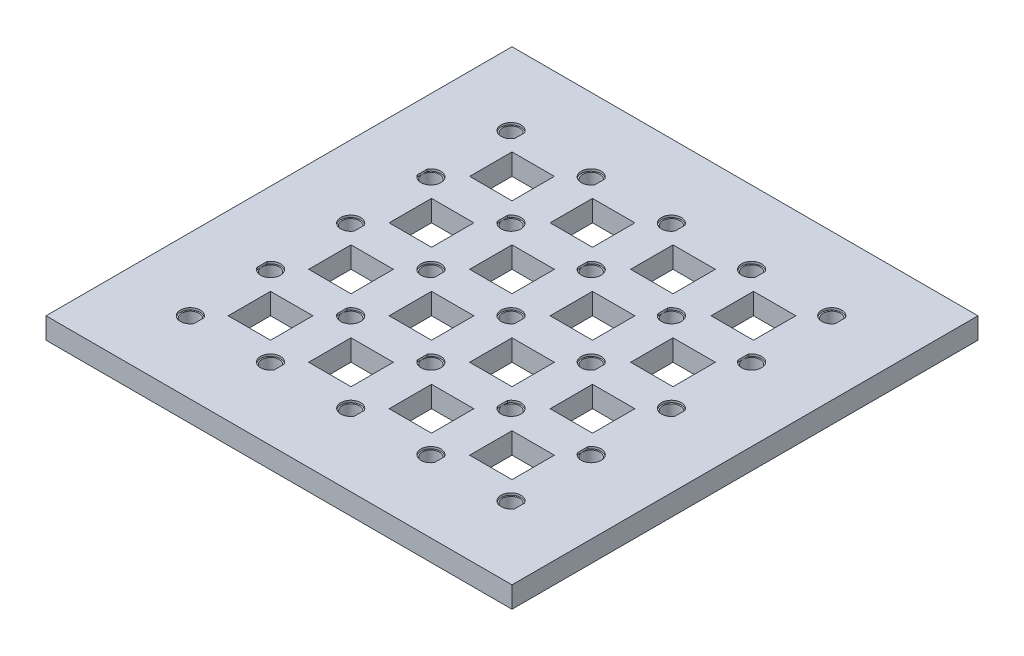
from build123d import *

# Parameters (mm, degrees)
SKETCH1_W           = 220
SKETCH1_H           = 220
BOSS_EXTRUDE1_DEPTH = 10
SKETCH2_R           = 4.075
CUT_EXTRUDE1_DEPTH  = 10
CUT_EXTRUDE2_DEPTH  = 1
SKETCH4_W           = 20
SKETCH4_H           = 20
CUT_EXTRUDE3_DEPTH  = 156.884572681


with BuildPart() as part:
    # Sketch1 → Boss-Extrude1 (new body)
    with BuildSketch(Plane(origin=(0, 0, 0), x_dir=(1, 0, 0), z_dir=(0, 1, 0))):
        Rectangle(SKETCH1_W, SKETCH1_H)
    extrude(amount=BOSS_EXTRUDE1_DEPTH)

    # Sketch2 → Cut-Extrude1 (cut)
    with BuildSketch(Plane(origin=(0, 10, 0), x_dir=(1, 0, 0), z_dir=(0, 1, 0))):
        with Locations((-75.925, -75.925)):
            Circle(SKETCH2_R)
        with Locations((-38.075, -75.925)):
            Circle(SKETCH2_R)
        with Locations((-0.225, -75.925)):
            Circle(SKETCH2_R)
        with Locations((37.625, -75.925)):
            Circle(SKETCH2_R)
        with Locations((75.475, -75.925)):
            Circle(SKETCH2_R)
        with Locations((-75.925, -38.075)):
            Circle(SKETCH2_R)
        with Locations((-38.075, -38.075)):
            Circle(SKETCH2_R)
        with Locations((-0.225, -38.075)):
            Circle(SKETCH2_R)
        with Locations((37.625, -38.075)):
            Circle(SKETCH2_R)
        with Locations((75.475, -38.075)):
            Circle(SKETCH2_R)
        with Locations((-75.925, -0.225)):
            Circle(SKETCH2_R)
        with Locations((-38.075, -0.225)):
            Circle(SKETCH2_R)
        with Locations((-0.225, -0.225)):
            Circle(SKETCH2_R)
        with Locations((37.625, -0.225)):
            Circle(SKETCH2_R)
        with Locations((75.475, -0.225)):
            Circle(SKETCH2_R)
        with Locations((-75.925, 37.625)):
            Circle(SKETCH2_R)
        with Locations((-38.075, 37.625)):
            Circle(SKETCH2_R)
        with Locations((-0.225, 37.625)):
            Circle(SKETCH2_R)
        with Locations((37.625, 37.625)):
            Circle(SKETCH2_R)
        with Locations((75.475, 37.625)):
            Circle(SKETCH2_R)
        with Locations((-75.925, 75.475)):
            Circle(SKETCH2_R)
        with Locations((-38.075, 75.475)):
            Circle(SKETCH2_R)
        with Locations((-0.225, 75.475)):
            Circle(SKETCH2_R)
        with Locations((37.625, 75.475)):
            Circle(SKETCH2_R)
        with Locations((75.475, 75.475)):
            Circle(SKETCH2_R)
    extrude(amount=-CUT_EXTRUDE1_DEPTH, mode=Mode.SUBTRACT)

    # Sketch3 → Cut-Extrude2 (cut)
    with BuildSketch(Plane(origin=(0, 10, 0), x_dir=(1, 0, 0), z_dir=(0, 1, 0))):
        with BuildLine():
            Line((-71.85, -78.266874249), (-71.85, -73.583125751))
            ThreePointArc((-71.85, -73.583125751), (-80.625, -75.925), (-71.85, -78.266874249))
        make_face()
        with BuildLine():
            Line((-80, -35.733125751), (-80, -40.416874249))
            ThreePointArc((-80, -40.416874249), (-71.225, -38.075), (-80, -35.733125751))
        make_face()
        with BuildLine():
            Line((-71.85, -2.566874249), (-71.85, 2.116874249))
            ThreePointArc((-71.85, 2.116874249), (-80.625, -0.225), (-71.85, -2.566874249))
        make_face()
        with BuildLine():
            Line((-80, 39.966874249), (-80, 35.283125751))
            ThreePointArc((-80, 35.283125751), (-71.225, 37.625), (-80, 39.966874249))
        make_face()
        with BuildLine():
            Line((-71.85, 73.133125751), (-71.85, 77.816874249))
            ThreePointArc((-71.85, 77.816874249), (-80.625, 75.475), (-71.85, 73.133125751))
        make_face()
        with BuildLine():
            Line((-34, 73.133125751), (-34, 77.816874249))
            ThreePointArc((-34, 77.816874249), (-42.775, 75.475), (-34, 73.133125751))
        make_face()
        with BuildLine():
            Line((-42.15, 39.966874249), (-42.15, 35.283125751))
            ThreePointArc((-42.15, 35.283125751), (-33.375, 37.625), (-42.15, 39.966874249))
        make_face()
        with BuildLine():
            Line((-34, -2.566874249), (-34, 2.116874249))
            ThreePointArc((-34, 2.116874249), (-42.775, -0.225), (-34, -2.566874249))
        make_face()
        with BuildLine():
            Line((-34, -78.266874249), (-34, -73.583125751))
            ThreePointArc((-34, -73.583125751), (-42.775, -75.925), (-34, -78.266874249))
        make_face()
        with BuildLine():
            Line((-42.15, -35.733125751), (-42.15, -40.416874249))
            ThreePointArc((-42.15, -40.416874249), (-33.375, -38.075), (-42.15, -35.733125751))
        make_face()
        with BuildLine():
            Line((3.85, 73.133125751), (3.85, 77.816874249))
            ThreePointArc((3.85, 77.816874249), (-4.925, 75.475), (3.85, 73.133125751))
        make_face()
        with BuildLine():
            Line((-4.3, 39.966874249), (-4.3, 35.283125751))
            ThreePointArc((-4.3, 35.283125751), (4.475, 37.625), (-4.3, 39.966874249))
        make_face()
        with BuildLine():
            Line((3.85, -2.566874249), (3.85, 2.116874249))
            ThreePointArc((3.85, 2.116874249), (-4.925, -0.225), (3.85, -2.566874249))
        make_face()
        with BuildLine():
            Line((3.85, -78.266874249), (3.85, -73.583125751))
            ThreePointArc((3.85, -73.583125751), (-4.925, -75.925), (3.85, -78.266874249))
        make_face()
        with BuildLine():
            Line((-4.3, -35.733125751), (-4.3, -40.416874249))
            ThreePointArc((-4.3, -40.416874249), (4.475, -38.075), (-4.3, -35.733125751))
        make_face()
        with BuildLine():
            Line((41.7, 73.133125751), (41.7, 77.816874249))
            ThreePointArc((41.7, 77.816874249), (32.925, 75.475), (41.7, 73.133125751))
        make_face()
        with BuildLine():
            Line((33.55, 39.966874249), (33.55, 35.283125751))
            ThreePointArc((33.55, 35.283125751), (42.325, 37.625), (33.55, 39.966874249))
        make_face()
        with BuildLine():
            Line((41.7, -2.566874249), (41.7, 2.116874249))
            ThreePointArc((41.7, 2.116874249), (32.925, -0.225), (41.7, -2.566874249))
        make_face()
        with BuildLine():
            Line((41.7, -78.266874249), (41.7, -73.583125751))
            ThreePointArc((41.7, -73.583125751), (32.925, -75.925), (41.7, -78.266874249))
        make_face()
        with BuildLine():
            Line((33.55, -35.733125751), (33.55, -40.416874249))
            ThreePointArc((33.55, -40.416874249), (42.325, -38.075), (33.55, -35.733125751))
        make_face()
        with BuildLine():
            Line((79.55, 73.133125751), (79.55, 77.816874249))
            ThreePointArc((79.55, 77.816874249), (70.775, 75.475), (79.55, 73.133125751))
        make_face()
        with BuildLine():
            Line((71.4, 39.966874249), (71.4, 35.283125751))
            ThreePointArc((71.4, 35.283125751), (80.175, 37.625), (71.4, 39.966874249))
        make_face()
        with BuildLine():
            Line((79.55, -2.566874249), (79.55, 2.116874249))
            ThreePointArc((79.55, 2.116874249), (70.775, -0.225), (79.55, -2.566874249))
        make_face()
        with BuildLine():
            Line((79.55, -78.266874249), (79.55, -73.583125751))
            ThreePointArc((79.55, -73.583125751), (70.775, -75.925), (79.55, -78.266874249))
        make_face()
        with BuildLine():
            Line((71.4, -35.733125751), (71.4, -40.416874249))
            ThreePointArc((71.4, -40.416874249), (80.175, -38.075), (71.4, -35.733125751))
        make_face()
    extrude(amount=-CUT_EXTRUDE2_DEPTH, mode=Mode.SUBTRACT)

    # Sketch4 → Cut-Extrude3 (cut, through all)
    with BuildSketch(Plane(origin=(0, 10, 0), x_dir=(1, 0, 0), z_dir=(0, 1, 0))):
        with Locations((-57, 57)):
            Rectangle(SKETCH4_W, SKETCH4_H)
        with Locations((-19, 57)):
            Rectangle(SKETCH4_W, SKETCH4_H)
        with Locations((19, 57)):
            Rectangle(SKETCH4_W, SKETCH4_H)
        with Locations((57, 57)):
            Rectangle(SKETCH4_W, SKETCH4_H)
        with Locations((-19, 19)):
            Rectangle(SKETCH4_W, SKETCH4_H)
        with Locations((19, 19)):
            Rectangle(SKETCH4_W, SKETCH4_H)
        with Locations((57, 19)):
            Rectangle(SKETCH4_W, SKETCH4_H)
        with Locations((-57, 19)):
            Rectangle(SKETCH4_W, SKETCH4_H)
        with Locations((-19, -19)):
            Rectangle(SKETCH4_W, SKETCH4_H)
        with Locations((19, -19)):
            Rectangle(SKETCH4_W, SKETCH4_H)
        with Locations((57, -19)):
            Rectangle(SKETCH4_W, SKETCH4_H)
        with Locations((-57, -19)):
            Rectangle(SKETCH4_W, SKETCH4_H)
        with Locations((-19, -57)):
            Rectangle(SKETCH4_W, SKETCH4_H)
        with Locations((19, -57)):
            Rectangle(SKETCH4_W, SKETCH4_H)
        with Locations((57, -57)):
            Rectangle(SKETCH4_W, SKETCH4_H)
        with Locations((-57, -57)):
            Rectangle(SKETCH4_W, SKETCH4_H)
    extrude(amount=-CUT_EXTRUDE3_DEPTH, mode=Mode.SUBTRACT)


solid = part.part
